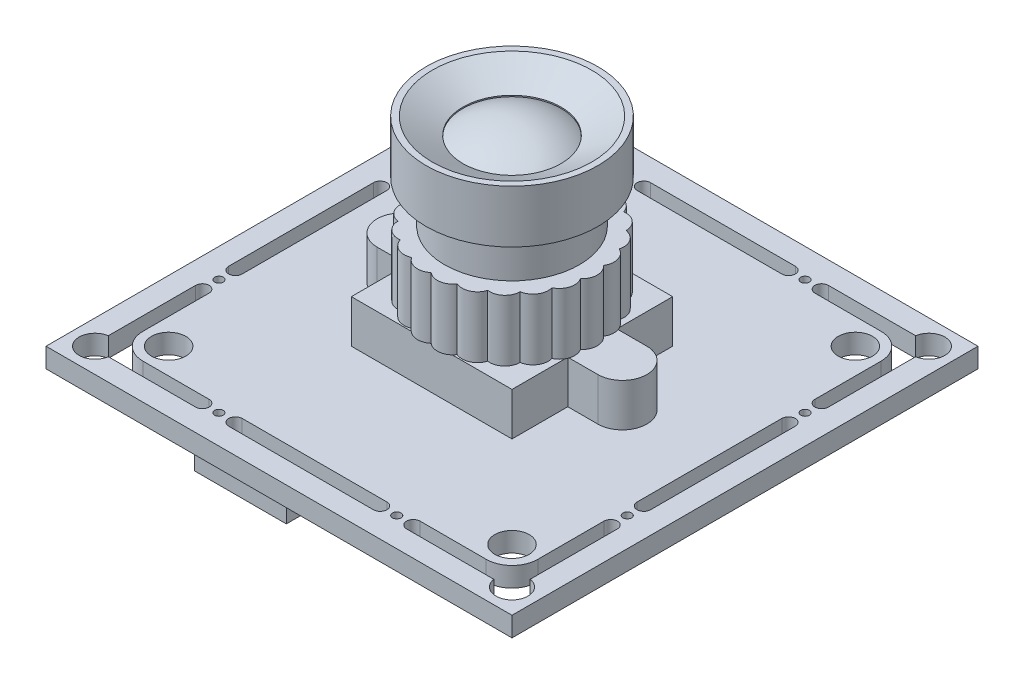
from build123d import *

# Parameters (mm, degrees)
SKETCH1_W           = 38
SKETCH1_H           = 38
BOSS_EXTRUDE1_DEPTH = 1.6
BOSS_EXTRUDE2_DEPTH = 3.5
SKETCH3_R           = 1.25
BOSS_EXTRUDE3_DEPTH = 5
CIRPATTERN1_COUNT   = 22
SKETCH5_W           = 7.5
SKETCH5_H           = 3.75
BOSS_EXTRUDE4_DEPTH = 4.75
SKETCH6_R           = 1.4
SKETCH6_R_2         = 0.35
CUT_EXTRUDE1_DEPTH  = 32.401632123


with BuildPart() as part:
    # Sketch1 → Boss-Extrude1 (new body)
    with BuildSketch(Plane(origin=(0, 0, 0), x_dir=(1, 0, 0), z_dir=(0, 1, 0))):
        Rectangle(SKETCH1_W, SKETCH1_H)
    extrude(amount=BOSS_EXTRUDE1_DEPTH)

    # Sketch2 → Boss-Extrude2 (add)
    with BuildSketch(Plane(origin=(0, 1.6, 0), x_dir=(1, 0, 0), z_dir=(0, 1, 0))):
        with BuildLine():
            Line((-6.55, 2), (-9, 2))
            ThreePointArc((-9, 2), (-11, 0), (-9, -2))
            Line((-9, -2), (-6.55, -2))
            Line((-6.55, -2), (-6.55, -6.55))
            Line((-6.55, -6.55), (6.55, -6.55))
            Line((6.55, -6.55), (6.55, -2))
            Line((6.55, -2), (9, -2))
            ThreePointArc((9, -2), (11, 0), (9, 2))
            Line((9, 2), (6.55, 2))
            Line((6.55, 2), (6.55, 6.55))
            Line((6.55, 6.55), (-6.55, 6.55))
            Line((-6.55, 6.55), (-6.55, 2))
        make_face()
    extrude(amount=BOSS_EXTRUDE2_DEPTH)

    # Sketch4 → Revolve1 (revolve)
    with BuildSketch(Plane.XY):
        with BuildLine():
            Line((0, 0), (0, 17.65))
            ThreePointArc((0, 17.65), (-2.096194346, 17.328770041), (-4, 16.394562647))
            Line((-4, 16.394562647), (-4, 16.494562647))
            Line((-4, 16.494562647), (-6.5, 17.85))
            Line((-6.5, 17.85), (-7, 17.85))
            Line((-7, 17.85), (-7, 13.55))
            Line((-7, 13.55), (-5.5, 13.55))
            Line((-5.5, 13.55), (-5.5, 0))
            Line((-5.5, 0), (0, 0))
        make_face()
    revolve(axis=Axis((0, 0, 0), (0, -1, 0)))

    # Sketch3 → Boss-Extrude3 (add)
    with BuildSketch(Plane(origin=(0, 5.1, 0), x_dir=(1, 0, 0), z_dir=(0, 1, 0))):
        with Locations((5.7, 0)):
            Circle(SKETCH3_R)
    boss_extrude3 = extrude(amount=BOSS_EXTRUDE3_DEPTH)

    # CirPattern1: Boss-Extrude3 ×22 about axis
    cirpattern1_axis = Axis((0, 0, 0), (0, 1, 0))
    for i in range(1, CIRPATTERN1_COUNT):
        add(boss_extrude3.rotate(cirpattern1_axis, i * 360 / CIRPATTERN1_COUNT))

    # Sketch5 → Boss-Extrude4 (add)
    with BuildSketch(Plane.XZ):
        with Locations((-6.75, 13.525)):
            Rectangle(SKETCH5_W, SKETCH5_H)
    extrude(amount=BOSS_EXTRUDE4_DEPTH)

    # Sketch6 → Cut-Extrude1 (cut, through all)
    with BuildSketch(Plane(origin=(0, 1.6, 0), x_dir=(1, 0, 0), z_dir=(0, 1, 0))):
        with Locations((-14, 14)):
            Circle(SKETCH6_R)
        with Locations((-7.25, 16.65)):
            Circle(SKETCH6_R_2)
        with Locations((7.25, 16.65)):
            Circle(SKETCH6_R_2)
        with Locations((14, 14)):
            Circle(SKETCH6_R)
        with Locations((16.65, 7.25)):
            Circle(SKETCH6_R_2)
        with Locations((16.65, -7.25)):
            Circle(SKETCH6_R_2)
        with Locations((14, -14)):
            Circle(SKETCH6_R)
        with Locations((7.25, -16.65)):
            Circle(SKETCH6_R_2)
        with Locations((-7.25, -16.65)):
            Circle(SKETCH6_R_2)
        with Locations((-14, -14)):
            Circle(SKETCH6_R)
        with Locations((-16.65, -7.25)):
            Circle(SKETCH6_R_2)
        with Locations((-16.65, 7.25)):
            Circle(SKETCH6_R_2)
        with BuildLine():
            Line((-15.715476742, 17.2), (-8.6, 17.2))
            ThreePointArc((-8.6, 17.2), (-8.05, 16.65), (-8.6, 16.1))
            Line((-8.6, 16.1), (-14, 16.1))
            ThreePointArc((-14, 16.1), (-15.48492424, 15.48492424), (-16.1, 14))
            Line((-16.1, 14), (-16.1, 8.6))
            ThreePointArc((-16.1, 8.6), (-16.65, 8.05), (-17.2, 8.6))
            Line((-17.2, 8.6), (-17.2, 15.715476742))
            ThreePointArc((-17.2, 15.715476742), (-17.919238816, 17.919238816), (-15.715476742, 17.2))
        make_face()
        with BuildLine():
            Line((-5.9, 17.2), (5.9, 17.2))
            ThreePointArc((5.9, 17.2), (6.45, 16.65), (5.9, 16.1))
            Line((5.9, 16.1), (-5.9, 16.1))
            ThreePointArc((-5.9, 16.1), (-6.45, 16.65), (-5.9, 17.2))
        make_face()
        with BuildLine():
            Line((14, 16.1), (8.6, 16.1))
            ThreePointArc((8.6, 16.1), (8.05, 16.65), (8.6, 17.2))
            Line((8.6, 17.2), (15.715476742, 17.2))
            ThreePointArc((15.715476742, 17.2), (17.919238816, 17.919238816), (17.2, 15.715476742))
            Line((17.2, 15.715476742), (17.2, 8.6))
            ThreePointArc((17.2, 8.6), (16.65, 8.05), (16.1, 8.6))
            Line((16.1, 8.6), (16.1, 14))
            ThreePointArc((16.1, 14), (15.48492424, 15.48492424), (14, 16.1))
        make_face()
        with BuildLine():
            Line((16.1, -5.9), (16.1, 5.9))
            ThreePointArc((16.1, 5.9), (16.65, 6.45), (17.2, 5.9))
            Line((17.2, 5.9), (17.2, -5.9))
            ThreePointArc((17.2, -5.9), (16.65, -6.45), (16.1, -5.9))
        make_face()
        with BuildLine():
            Line((16.1, -14), (16.1, -8.6))
            ThreePointArc((16.1, -8.6), (16.65, -8.05), (17.2, -8.6))
            Line((17.2, -8.6), (17.2, -15.715476742))
            ThreePointArc((17.2, -15.715476742), (17.919238816, -17.919238816), (15.715476742, -17.2))
            Line((15.715476742, -17.2), (8.6, -17.2))
            ThreePointArc((8.6, -17.2), (8.05, -16.65), (8.6, -16.1))
            Line((8.6, -16.1), (14, -16.1))
            ThreePointArc((14, -16.1), (15.48492424, -15.48492424), (16.1, -14))
        make_face()
        with BuildLine():
            Line((-5.9, -16.1), (5.9, -16.1))
            ThreePointArc((5.9, -16.1), (6.45, -16.65), (5.9, -17.2))
            Line((5.9, -17.2), (-5.9, -17.2))
            ThreePointArc((-5.9, -17.2), (-6.45, -16.65), (-5.9, -16.1))
        make_face()
        with BuildLine():
            Line((-14, -16.1), (-8.6, -16.1))
            ThreePointArc((-8.6, -16.1), (-8.05, -16.65), (-8.6, -17.2))
            Line((-8.6, -17.2), (-15.715476742, -17.2))
            ThreePointArc((-15.715476742, -17.2), (-17.919238816, -17.919238816), (-17.2, -15.715476742))
            Line((-17.2, -15.715476742), (-17.2, -8.6))
            ThreePointArc((-17.2, -8.6), (-16.65, -8.05), (-16.1, -8.6))
            Line((-16.1, -8.6), (-16.1, -14))
            ThreePointArc((-16.1, -14), (-15.48492424, -15.48492424), (-14, -16.1))
        make_face()
        with BuildLine():
            Line((-16.1, 5.9), (-16.1, -5.9))
            ThreePointArc((-16.1, -5.9), (-16.65, -6.45), (-17.2, -5.9))
            Line((-17.2, -5.9), (-17.2, 5.9))
            ThreePointArc((-17.2, 5.9), (-16.65, 6.45), (-16.1, 5.9))
        make_face()
    extrude(amount=-CUT_EXTRUDE1_DEPTH, mode=Mode.SUBTRACT)


solid = part.part
